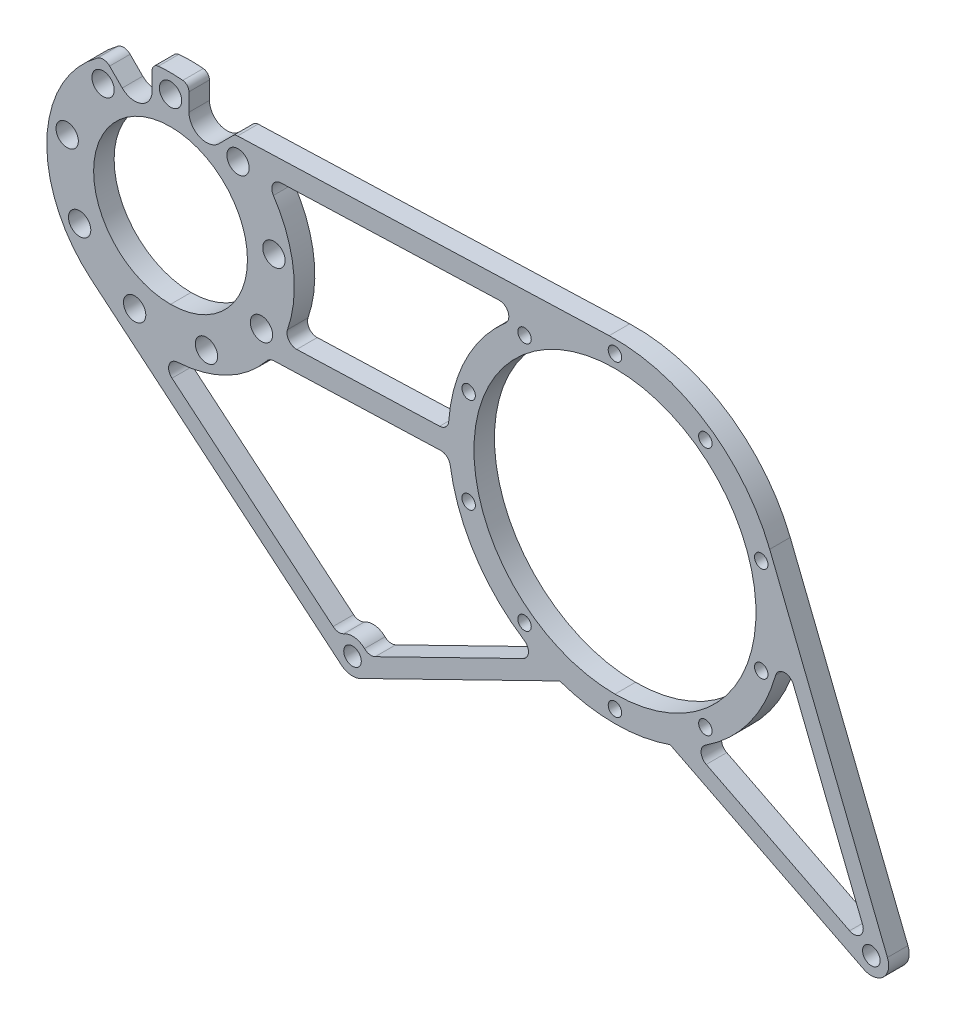
from build123d import *

# Parameters (mm, degrees)
SKETCH2_R               = 28.575
SKETCH2_R_2             = 3.2639
SKETCH2_R_3             = 52.3875
BOSS_EXTRUDE1_DEPTH     = 7.62
CUT_EXTRUDE1_DEPTH      = 369.573342704
CUT_EXTRUDE1_DEPTH_BACK = 369.573342704
SKETCH3_R               = 4.15
SKETCH3_R_2             = 2.5
CUT_EXTRUDE2_DEPTH      = 369.573342704
CUT_EXTRUDE2_DEPTH_BACK = 369.573342704


with BuildPart() as part:
    # Sketch2 → Boss-Extrude1 (new body)
    with BuildSketch(Plane.XY):
        with BuildLine():
            Line((-308.866129262, 91.710399516), (-215.926365234, 14.107506231))
            ThreePointArc((-215.926365234, 14.107506231), (-212.572921228, 12.657721799), (-208.970475069, 13.265869211))
            Line((-208.970475069, 13.265869211), (-134.814952137, 49.535152614))
            ThreePointArc((-134.814952137, 49.535152614), (-114.3, 46.0375), (-93.785047863, 49.535152614))
            Line((-93.785047863, 49.535152614), (-21.949808906, 13.301039962))
            ThreePointArc((-21.949808906, 13.301039962), (-14.699565425, 14.303090245), (-13.070560605, 21.438668609))
            Line((-13.070560605, 21.438668609), (-56.805390428, 130.917967399))
            ThreePointArc((-56.805390428, 130.917967399), (-80.468257666, 159.801430712), (-116.436314755, 169.825631839))
            Line((-116.436314755, 169.825631839), (-254.491729173, 165.059137987))
            ThreePointArc((-254.491729173, 165.059137987), (-255.416448823, 164.850182772), (-256.200136715, 164.316701751))
            Line((-256.200136715, 164.316701751), (-261.465020333, 159.051818133))
            ThreePointArc((-261.465020333, 159.051818133), (-268.548656721, 157.642795249), (-272.56121441, 163.648012211))
            Line((-272.56121441, 163.648012211), (-272.56121441, 170.220745001))
            ThreePointArc((-272.56121441, 170.220745001), (-273.218379704, 171.925600851), (-274.84982344, 172.748273949))
            ThreePointArc((-274.84982344, 172.748273949), (-279.4, 172.974), (-283.95017656, 172.748273949))
            ThreePointArc((-283.95017656, 172.748273949), (-285.581620296, 171.925600851), (-286.23878559, 170.220745001))
            Line((-286.23878559, 170.220745001), (-286.23878559, 163.648012211))
            ThreePointArc((-286.23878559, 163.648012211), (-290.251343279, 157.642795249), (-297.334979667, 159.051818133))
            Line((-297.334979667, 159.051818133), (-302.027964646, 163.744803112))
            ThreePointArc((-302.027964646, 163.744803112), (-304.229986022, 164.757469568), (-306.560860086, 164.09307692))
            ThreePointArc((-306.560860086, 164.09307692), (-325.350701602, 128.463454238), (-308.866129262, 91.710399516))
        make_face()
        with Locations((-279.4, 127)):
            Circle(SKETCH2_R, mode=Mode.SUBTRACT)
        with Locations((-19.05, 19.05)):
            Circle(SKETCH2_R_2, mode=Mode.SUBTRACT)
        with Locations((-211.799479175, 19.05)):
            Circle(SKETCH2_R_2, mode=Mode.SUBTRACT)
        with Locations((-114.3, 107.95)):
            Circle(SKETCH2_R_3, mode=Mode.SUBTRACT)
    extrude(amount=BOSS_EXTRUDE1_DEPTH)

    # Sketch3 → Cut-Extrude1 (cut, two sides: drawn at the far end of the back side and taken through both)
    with BuildSketch(Plane.XY.offset(7.62).offset(-CUT_EXTRUDE1_DEPTH_BACK)):
        with Locations((-279.4, 166)):
            Circle(SKETCH3_R)
        with Locations((-254.331283222, 156.875733282)):
            Circle(SKETCH3_R)
        with Locations((-240.992497633, 133.772278929)):
            Circle(SKETCH3_R)
        with Locations((-245.625009252, 107.5)):
            Circle(SKETCH3_R)
        with Locations((-266.06121441, 90.351987789)):
            Circle(SKETCH3_R)
        with Locations((-292.73878559, 90.351987789)):
            Circle(SKETCH3_R)
        with Locations((-313.174990748, 107.5)):
            Circle(SKETCH3_R)
        with Locations((-317.807502367, 133.772278929)):
            Circle(SKETCH3_R)
        with Locations((-304.468716778, 156.875733282)):
            Circle(SKETCH3_R)
        with Locations((-114.3, 165.1)):
            Circle(SKETCH3_R_2)
        with Locations((-80.708072831, 154.185321229)):
            Circle(SKETCH3_R_2)
        with Locations((-59.947120094, 125.610321229)):
            Circle(SKETCH3_R_2)
        with Locations((-59.947120094, 90.289678771)):
            Circle(SKETCH3_R_2)
        with Locations((-80.708072831, 61.714678771)):
            Circle(SKETCH3_R_2)
        with Locations((-114.3, 50.8)):
            Circle(SKETCH3_R_2)
        with Locations((-147.891927169, 61.714678771)):
            Circle(SKETCH3_R_2)
        with Locations((-168.652879906, 90.289678771)):
            Circle(SKETCH3_R_2)
        with Locations((-168.652879906, 125.610321229)):
            Circle(SKETCH3_R_2)
        with Locations((-147.891927169, 154.185321229)):
            Circle(SKETCH3_R_2)
    extrude(amount=CUT_EXTRUDE1_DEPTH + CUT_EXTRUDE1_DEPTH_BACK, mode=Mode.SUBTRACT)

    # Sketch4 → Cut-Extrude2 (cut, two sides: drawn at the far end of the back side and taken through both)
    with BuildSketch(Plane.XY.offset(7.62).offset(-CUT_EXTRUDE2_DEPTH_BACK)):
        with BuildLine():
            Line((-278.862624236, 74.930604639), (-219.018129111, 24.961616472))
            ThreePointArc((-219.018129111, 24.961616472), (-217.07692299, 24.16262829), (-215.028330647, 24.620812453))
            ThreePointArc((-215.028330647, 24.620812453), (-211.026037121, 25.442278201), (-207.335161059, 23.689967346))
            ThreePointArc((-207.335161059, 23.689967346), (-205.454963796, 22.756414152), (-203.379217054, 23.069365873))
            Line((-203.379217054, 23.069365873), (-148.393096208, 49.962941986))
            ThreePointArc((-148.393096208, 49.962941986), (-146.441473652, 52.888826728), (-148.025123052, 56.029158988))
            ThreePointArc((-148.025123052, 56.029158988), (-166.323384181, 74.383273103), (-175.505375311, 98.619421811))
            ThreePointArc((-175.505375311, 98.619421811), (-176.728150692, 100.781090012), (-179.078496289, 101.583501761))
            Line((-179.078496289, 101.583501761), (-241.00902327, 99.445291699))
            ThreePointArc((-241.00902327, 99.445291699), (-242.449700525, 99.079011388), (-243.607552711, 98.146761134))
            ThreePointArc((-243.607552711, 98.146761134), (-258.405489896, 86.099642771), (-276.820157686, 81.098441316))
            ThreePointArc((-276.820157686, 81.098441316), (-279.939618833, 78.709346862), (-278.862624236, 74.930604639))
        make_face()
        with BuildLine():
            Line((-48.019318761, 91.807143198), (-22.303873454, 27.434904147))
            ThreePointArc((-22.303873454, 27.434904147), (-23.187455951, 23.564521405), (-27.120033775, 23.021003007))
            Line((-27.120033775, 23.021003007), (-80.387932313, 49.889641079))
            ThreePointArc((-80.387932313, 49.889641079), (-82.302626367, 52.822384958), (-80.709884678, 55.941714036))
            ThreePointArc((-80.709884678, 55.941714036), (-64.405072396, 71.294115674), (-54.62867895, 91.442695545))
            ThreePointArc((-54.62867895, 91.442695545), (-51.454892751, 93.998716793), (-48.019318761, 91.807143198))
        make_face()
        with BuildLine():
            Line((-238.402359266, 157.990098388), (-157.34562354, 160.788658909))
            ThreePointArc((-157.34562354, 160.788658909), (-153.975579676, 158.578116117), (-154.932995767, 154.663138529))
            ThreePointArc((-154.932995767, 154.663138529), (-169.674997815, 135.640562892), (-176.049911565, 112.433980142))
            ThreePointArc((-176.049911565, 112.433980142), (-177.111003666, 110.170908338), (-179.412729847, 109.196502354))
            Line((-179.412729847, 109.196502354), (-232.522486776, 107.362837728))
            ThreePointArc((-232.522486776, 107.362837728), (-235.451809391, 108.777654869), (-235.944197319, 111.993271863))
            ThreePointArc((-235.944197319, 111.993271863), (-233.804940488, 132.890604733), (-241.184927886, 152.558109071))
            ThreePointArc((-241.184927886, 152.558109071), (-241.390248986, 156.091974283), (-238.402359266, 157.990098388))
        make_face()
    extrude(amount=CUT_EXTRUDE2_DEPTH + CUT_EXTRUDE2_DEPTH_BACK, mode=Mode.SUBTRACT)


solid = part.part
